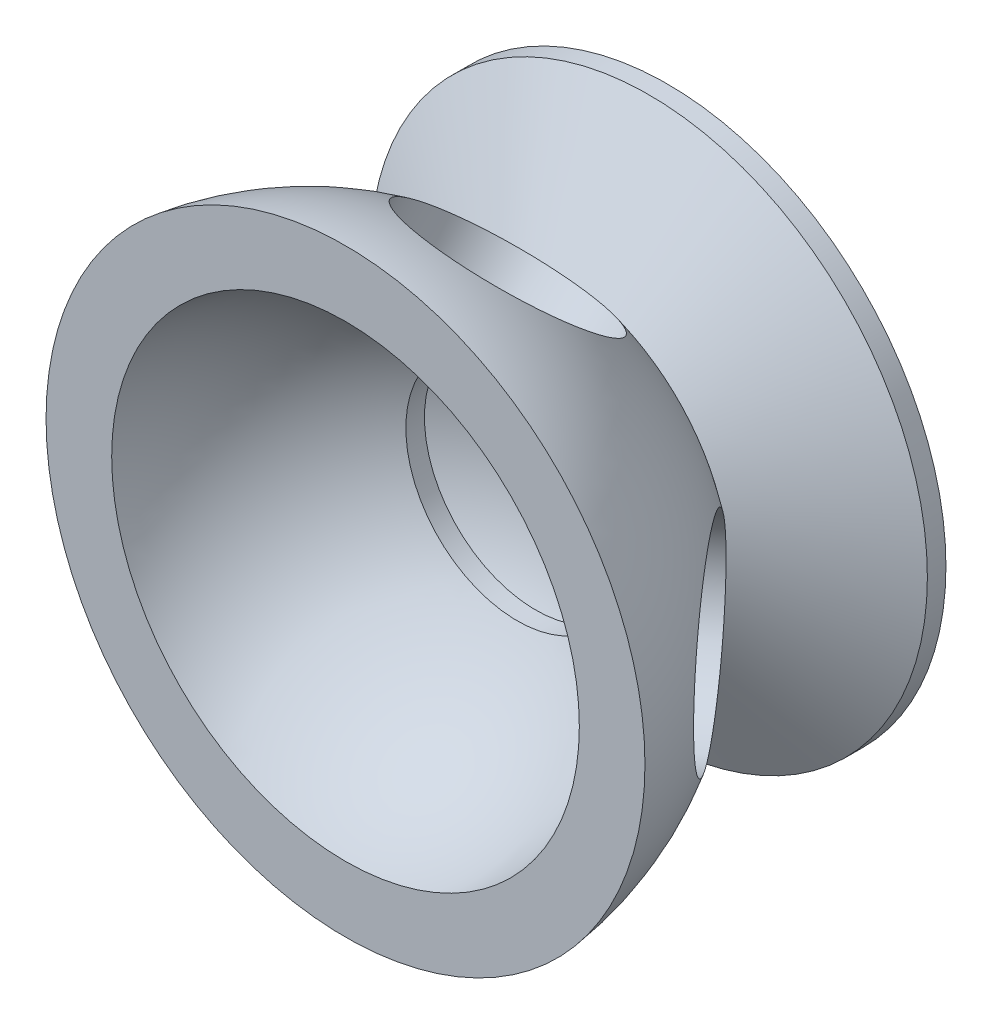
from build123d import *

# Parameters (mm, degrees)
F_10_0MM_START                             = 12.85
F_10_0MM_CLEARANCE_DOWEL_HOLE1_OUTLINE_R   = 5.2
F_10_0MM_CLEARANCE_DOWEL_HOLE1_DEPTH       = 3.4
F_10_0MM_CLEARANCE_DOWEL_HOLE1_2_OUTLINE_R = 5.2
F_10_0MM_CLEARANCE_DOWEL_HOLE1_2_DEPTH     = 3.4
F_10_0MM_START_2                           = -16.25
F_10_0MM_CLEARANCE_DOWEL_HOLE1_3_OUTLINE_R = 5.2
F_10_0MM_CLEARANCE_DOWEL_HOLE1_3_DEPTH     = 3.4
F_10_0MM_CLEARANCE_DOWEL_HOLE1_4_OUTLINE_R = 5.2
F_10_0MM_CLEARANCE_DOWEL_HOLE1_4_DEPTH     = 3.4


# Read off the part's stored shape, not the designer's step: Ø10.0mm Clearance Dowel Hole1
with BuildPart() as part:
    # Sketch2 → Revolve1 (revolve)
    with BuildSketch(Plane(origin=(0, 0, 0), x_dir=(1, 0, 0), z_dir=(0, 1, 0))):
        with BuildLine():
            Line((0, 19.335223808), (0, 20.835223808))
            Line((0, 20.835223808), (3.5, 20.835223808))
            Line((3.5, 20.835223808), (3.5, 19.335223808))
            Line((3.5, 19.335223808), (15, 19.335223808))
            Line((15, 19.335223808), (15, 18.335223808))
            Line((15, 18.335223808), (7.652702684, 14.335223808))
            ThreePointArc((7.652702684, 14.335223808), (13.394084623, 9.201141077), (16.126453423, 2))
            Line((16.126453423, 2), (12.592160259, 2))
            ThreePointArc((12.592160259, 2), (10.383050167, 7.399646561), (6, 11.25))
            Line((6, 11.25), (6, 12.25))
            ThreePointArc((6, 12.25), (3.082974877, 13.314034437), (0, 13.683453923))
            Line((0, 13.683453923), (0, 14.335223808))
            Line((0, 14.335223808), (0, 19.335223808))
        make_face()
    revolve(axis=Axis((0, 0, 0), (0, 0, -1)))

    # Ø10.0mm Clearance Dowel Hole1 outline → Ø10.0mm Clearance Dowel Hole1 (cut)
    with BuildSketch(Plane(origin=(0, 0, 0), x_dir=(0.6183381372049325, 0.009621176242523823, 0.7858532821370949), z_dir=(0.7859121758046087, -0.0075697264639421865, -0.6182918009834247)).offset(F_10_0MM_START)):
        Circle(F_10_0MM_CLEARANCE_DOWEL_HOLE1_OUTLINE_R)
    extrude(amount=F_10_0MM_CLEARANCE_DOWEL_HOLE1_DEPTH, mode=Mode.SUBTRACT)

    # 10.0mm Clearance Dowel Hole1 2 outline → 10.0mm Clearance Dowel Hole1 2 (cut)
    with BuildSketch(Plane(origin=(0, 0, 0), x_dir=(0.9955100285365741, -0.07532499424889044, 0.05732301740587202), z_dir=(0.094656130721202, 0.792202117315513, -0.602873139422971)).offset(F_10_0MM_START)):
        Circle(F_10_0MM_CLEARANCE_DOWEL_HOLE1_2_OUTLINE_R)
    extrude(amount=F_10_0MM_CLEARANCE_DOWEL_HOLE1_2_DEPTH, mode=Mode.SUBTRACT)

    # 10.0mm Clearance Dowel Hole1 3 outline → 10.0mm Clearance Dowel Hole1 3 (cut)
    with BuildSketch(Plane(origin=(0, 0, 0), x_dir=(0.6223977246894614, -0.0005766674334576965, -0.7827009261244378), z_dir=(0.7827011385588891, 0.00045856135989200104, 0.6223975557632742)).offset(F_10_0MM_START_2)):
        Circle(F_10_0MM_CLEARANCE_DOWEL_HOLE1_3_OUTLINE_R)
    extrude(amount=F_10_0MM_CLEARANCE_DOWEL_HOLE1_3_DEPTH, mode=Mode.SUBTRACT)

    # 10.0mm Clearance Dowel Hole1 4 outline → 10.0mm Clearance Dowel Hole1 4 (cut)
    with BuildSketch(Plane(origin=(0, 0, 0), x_dir=(0.9995880641663693, -0.02335534361896009, -0.0166802248357377), z_dir=(0.02870020864262942, 0.8134339024051715, 0.5809488655998595)).offset(F_10_0MM_START_2)):
        Circle(F_10_0MM_CLEARANCE_DOWEL_HOLE1_4_OUTLINE_R)
    extrude(amount=F_10_0MM_CLEARANCE_DOWEL_HOLE1_4_DEPTH, mode=Mode.SUBTRACT)


solid = part.part
